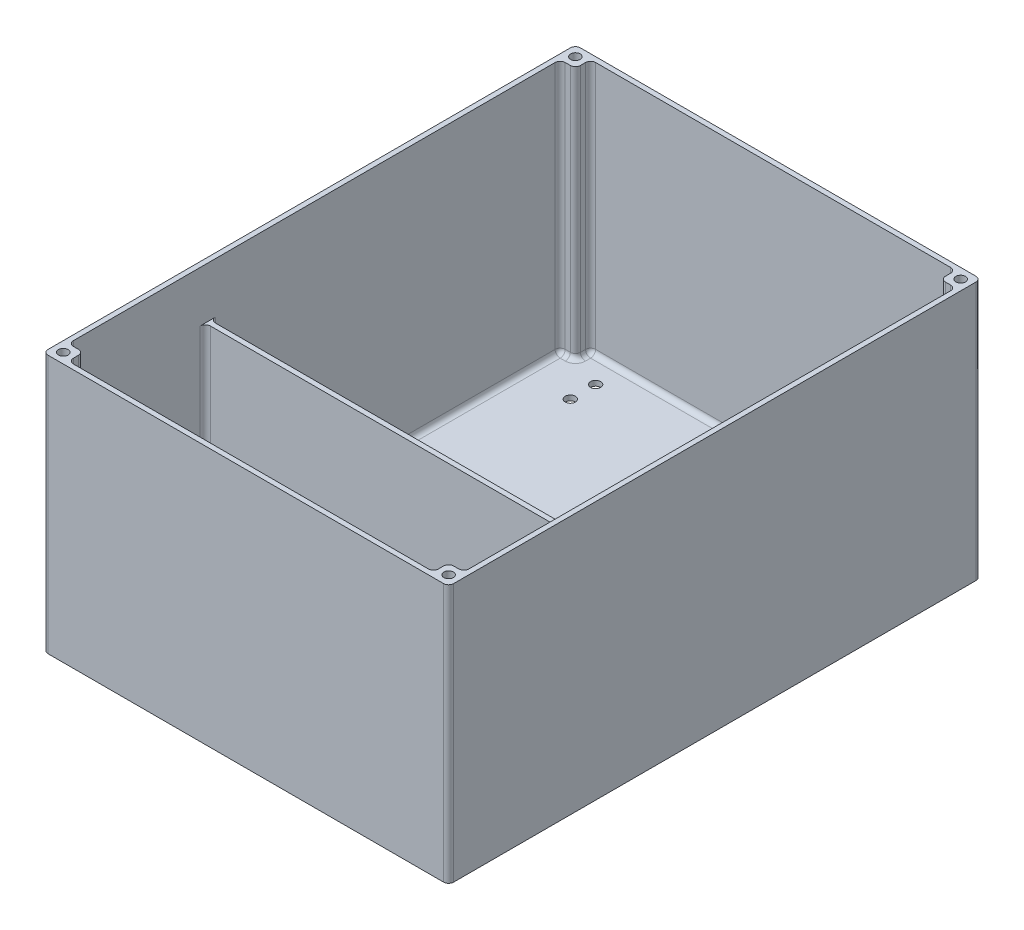
from build123d import *

# Parameters (mm, degrees)
SKETCH1_W           = 160
SKETCH1_H           = 210
BOSS_EXTRUDE3_DEPTH = 2
SKETCH3_W           = 160
SKETCH3_H           = 210
BOSS_EXTRUDE4_DEPTH = 100
FILLET1_R           = 2
SKETCH4_R           = 1.9
CUT_EXTRUDE1_DEPTH  = 10
SKETCH5_R           = 2
CUT_EXTRUDE2_DEPTH  = 10
SKETCH6_W           = 156
SKETCH6_H           = 2
BOSS_EXTRUDE5_DEPTH = 80
FILLET2_R           = 2


with BuildPart() as part:
    # Sketch1 → Boss-Extrude3 (new body)
    with BuildSketch(Plane(origin=(0, 0, 0), x_dir=(1, 0, 0), z_dir=(0, 1, 0))):
        with Locations((80, 105)):
            Rectangle(SKETCH1_W, SKETCH1_H)
    extrude(amount=BOSS_EXTRUDE3_DEPTH)

    # Sketch3 → Boss-Extrude4 (add)
    with BuildSketch(Plane(origin=(0, 2, 0), x_dir=(1, 0, 0), z_dir=(0, 1, 0))):
        with Locations((80, 105)):
            Rectangle(SKETCH3_W, SKETCH3_H)
        Polygon((2, 202), (2, 8), (8, 8), (8, 2), (152, 2), (152, 8), (158, 8), (158, 202), (152, 202), (152, 208), (8, 208), (8, 202), align=None, mode=Mode.SUBTRACT)
    extrude(amount=BOSS_EXTRUDE4_DEPTH)

    # Fillet1
    fillet1_edges = [part.edges().sort_by_distance(p)[0] for p in [
        (160, 51, -210),
        (160, 51, 0),
        (0, 51, 0),
        (0, 51, -210),
        (2, 52, -8),
        (8, 52, -8),
        (8, 52, -2),
        (152, 52, -2),
        (152, 52, -8),
        (158, 52, -8),
        (158, 52, -202),
        (152, 52, -202),
        (152, 52, -208),
        (8, 52, -202),
        (8, 52, -208),
        (2, 52, -202),
    ]]
    fillet(fillet1_edges, radius=FILLET1_R)

    # Sketch4 → Cut-Extrude1 (cut)
    with BuildSketch(Plane(origin=(0, 102, 0), x_dir=(1, 0, 0), z_dir=(0, 1, 0))):
        with Locations((4, 206)):
            Circle(SKETCH4_R)
        with Locations((156, 206)):
            Circle(SKETCH4_R)
        with Locations((156, 4)):
            Circle(SKETCH4_R)
        with Locations((4, 4)):
            Circle(SKETCH4_R)
    extrude(amount=-CUT_EXTRUDE1_DEPTH, mode=Mode.SUBTRACT)

    # Sketch5 → Cut-Extrude2 (cut)
    with BuildSketch(Plane(origin=(0, 2, 0), x_dir=(1, 0, 0), z_dir=(0, 1, 0))):
        with Locations((20, 198)):
            Circle(SKETCH5_R)
        with Locations((140, 198)):
            Circle(SKETCH5_R)
        with Locations((140, 188)):
            Circle(SKETCH5_R)
        with Locations((20, 188)):
            Circle(SKETCH5_R)
        with Locations((20, 22)):
            Circle(SKETCH5_R)
        with Locations((140, 22)):
            Circle(SKETCH5_R)
        with Locations((140, 12)):
            Circle(SKETCH5_R)
        with Locations((20, 12)):
            Circle(SKETCH5_R)
    extrude(amount=-CUT_EXTRUDE2_DEPTH, mode=Mode.SUBTRACT)

    # Sketch6 → Boss-Extrude5 (add)
    with BuildSketch(Plane(origin=(0, 2, 0), x_dir=(1, 0, 0), z_dir=(0, 1, 0))):
        with Locations((80, 63)):
            Rectangle(SKETCH6_W, SKETCH6_H)
    extrude(amount=BOSS_EXTRUDE5_DEPTH)

    # Fillet2
    fillet2_edges = [part.edges().sort_by_distance(p)[0] for p in [
        (158, 2, -36),
        (157.414213562, 2, -8.585786438),
        (155, 2, -8),
        (152.585786438, 2, -7.414213562),
        (152, 2, -5),
        (151.414213562, 2, -2.585786438),
        (80, 2, -2),
        (8.585786438, 2, -2.585786438),
        (8, 2, -5),
        (7.414213562, 2, -7.414213562),
        (5, 2, -8),
        (2.585786438, 2, -8.585786438),
        (158, 2, -132),
        (157.414213562, 2, -201.414213562),
        (155, 2, -202),
        (152.585786438, 2, -202.585786438),
        (152, 2, -205),
        (151.414213562, 2, -207.414213562),
        (80, 2, -208),
        (8.585786438, 2, -207.414213562),
        (8, 2, -205),
        (7.414213562, 2, -202.585786438),
        (5, 2, -202),
        (2.585786438, 2, -201.414213562),
        (2, 2, -36),
        (2, 42, -62),
        (80, 2, -62),
        (158, 42, -62),
        (158, 42, -64),
        (2, 42, -64),
        (80, 2, -64),
        (2, 2, -132),
    ]]
    fillet(fillet2_edges, radius=FILLET2_R)


solid = part.part
